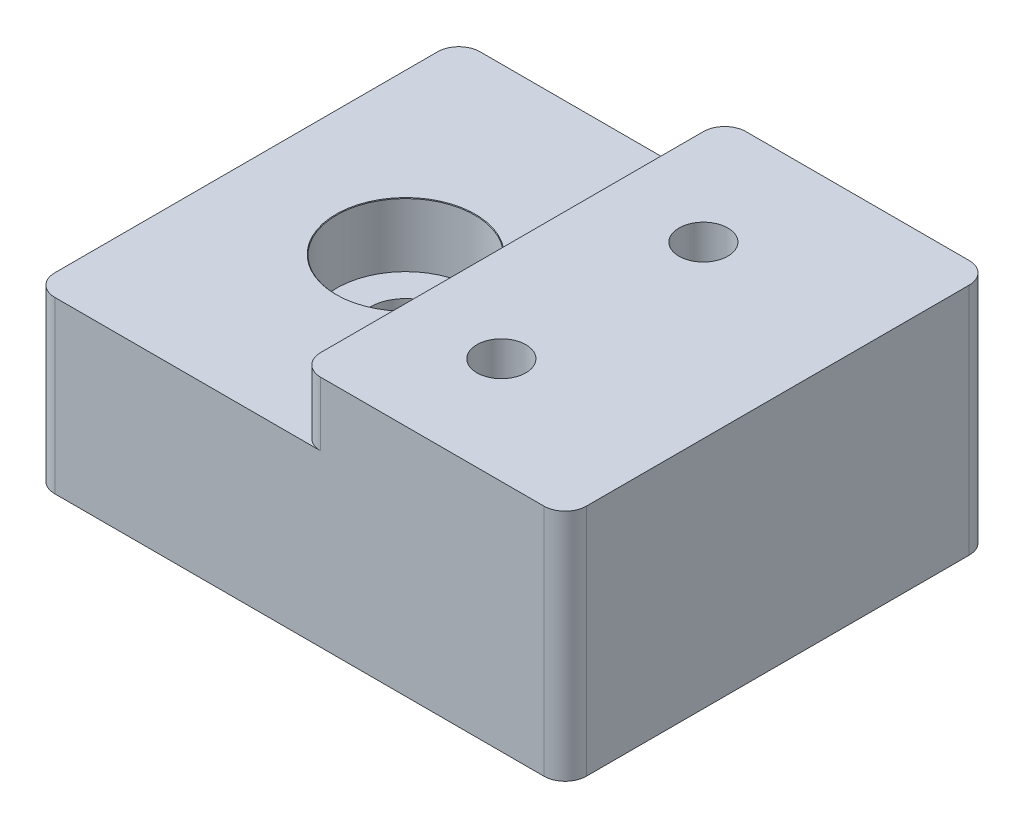
from build123d import *

# Parameters (mm, degrees)
SKETCH1_W           = 25
SKETCH1_H           = 20
BOSS_EXTRUDE1_DEPTH = 8
FILLET1_R           = 1
SKETCH5_R           = 1.15
CUT_EXTRUDE1_DEPTH  = 5
BOSS_EXTRUDE2_START = 3
SKETCH6_R           = 1.15
BOSS_EXTRUDE2_DEPTH = 3
FILLET2_R           = 1


with BuildPart() as part:
    # Sketch1 → Boss-Extrude1 (new body)
    with BuildSketch(Plane(origin=(0, 0, 0), x_dir=(1, 0, 0), z_dir=(0, 1, 0))):
        Rectangle(SKETCH1_W, SKETCH1_H)
    extrude(amount=BOSS_EXTRUDE1_DEPTH)

    # Sketch4 → CBORE for M3 SHCS1 (revolve, cut)
    with BuildSketch(Plane(origin=(-5, 8, 0), x_dir=(0, 0, 1), z_dir=(1, 0, 0))):
        Polygon((0, 0), (0, 8), (1.7, 8), (1.7, 3), (3.25, 3), (3.25, 0.025), (3.275, 0), align=None)
    revolve(axis=Axis((-5, 14.35, 0), (0, -1, 0)), mode=Mode.SUBTRACT)

    # Fillet1
    fillet1_edges = [part.edges().sort_by_distance(p)[0] for p in [
        (12.5, 4, 10),
        (-12.5, 4, 10),
        (12.5, 4, -10),
        (-12.5, 4, -10),
    ]]
    fillet(fillet1_edges, radius=FILLET1_R)

    # Sketch5 → Cut-Extrude1 (cut)
    with BuildSketch(Plane(origin=(0, 8, 0), x_dir=(1, 0, 0), z_dir=(0, 1, 0))):
        with Locations((4.5, 4.5)):
            Circle(SKETCH5_R)
        with Locations((4.5, -5)):
            Circle(SKETCH5_R)
    extrude(amount=-CUT_EXTRUDE1_DEPTH, mode=Mode.SUBTRACT)

    # Sketch6 → Boss-Extrude2 (add)
    with BuildSketch(Plane(origin=(0, 8, 0), x_dir=(1, 0, 0), z_dir=(0, 1, 0)).offset(BOSS_EXTRUDE2_START)):
        with BuildLine():
            Line((0, 10), (0, -10))
            Line((0, -10), (11.5, -10))
            ThreePointArc((11.5, -10), (12.207106781, -9.707106781), (12.5, -9))
            Line((12.5, -9), (12.5, 9))
            ThreePointArc((12.5, 9), (12.207106781, 9.707106781), (11.5, 10))
            Line((11.5, 10), (0, 10))
        make_face()
        with Locations((4.5, -5)):
            Circle(SKETCH6_R, mode=Mode.SUBTRACT)
        with Locations((4.5, 4.5)):
            Circle(SKETCH6_R, mode=Mode.SUBTRACT)
    extrude(amount=-BOSS_EXTRUDE2_DEPTH)

    # Fillet2
    fillet2_edges = [part.edges().sort_by_distance(p)[0] for p in [
        (0, 9.5, 10),
        (0, 9.5, -10),
    ]]
    fillet(fillet2_edges, radius=FILLET2_R)


solid = part.part
